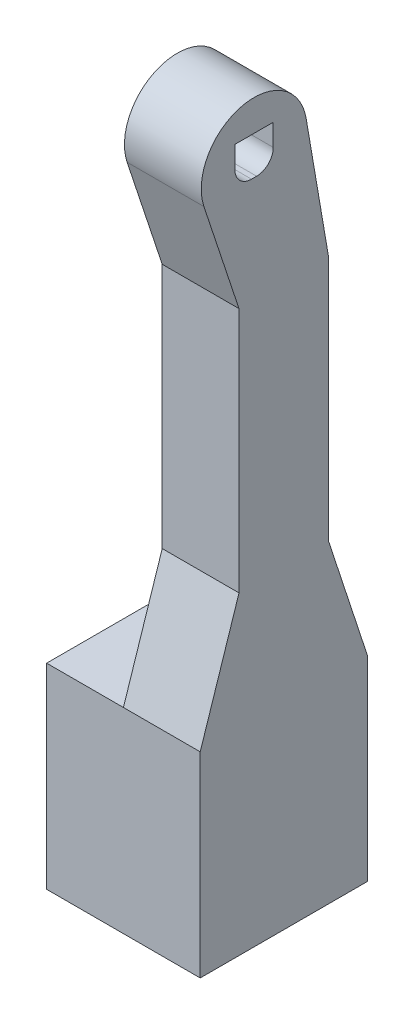
from build123d import *

# Parameters (mm, degrees)
BOSS_EXTRUDE2_DEPTH = 6
BOSS_EXTRUDE3_DEPTH = 6


with BuildPart() as part:
    # Sketch1 → Boss-Extrude2 (new body)
    with BuildSketch(Plane(origin=(0, 0, 0), x_dir=(0, 0, -1), z_dir=(1, 0, 0))):
        Polygon((-6.530112864, 15.3052734), (-6.530112864, 0), (-3, 0), (-3, 9.82), (3, 9.82), (3, 0), (6.530112864, 0), (6.530112864, 15.3052734), align=None)
    extrude(amount=-BOSS_EXTRUDE2_DEPTH)

    # Sketch1<4> → Boss-Extrude3 (add)
    with BuildSketch(Plane(origin=(0, 0, 0), x_dir=(0, 0, -1), z_dir=(1, 0, 0))):
        with BuildLine():
            Line((6.530112864, 0), (6.530112864, 15.3052734))
            Line((6.530112864, 15.3052734), (3.498344074, 24.541666174))
            Line((3.498344074, 24.541666174), (3.498344074, 43.778718631))
            Line((3.498344074, 43.778718631), (1.742466173, 54.048264378))
            ThreePointArc((1.742466173, 54.048264378), (-3.323802498, 57.355930134), (-6.240866628, 52.055131338))
            Line((-6.240866628, 52.055131338), (-3.498344074, 43.778718631))
            Line((-3.498344074, 43.778718631), (-3.498344074, 24.541666174))
            Line((-3.498344074, 24.541666174), (-6.530112864, 15.3052734))
            Line((-6.530112864, 15.3052734), (-6.530112864, 0))
            Line((-6.530112864, 0), (6.530112864, 0))
        make_face()
        with BuildLine():
            ThreePointArc((-2.524402568, 52.052914737), (-3.443641384, 52.433675922), (-3.824402568, 53.352914737))
            Line((-3.824402568, 53.352914737), (-3.824402568, 55.052914737))
            Line((-3.824402568, 55.052914737), (-0.824402568, 55.052914737))
            Line((-0.824402568, 55.052914737), (-0.824402568, 53.352914737))
            ThreePointArc((-0.824402568, 53.352914737), (-1.205163753, 52.433675922), (-2.124402568, 52.052914737))
            Line((-2.124402568, 52.052914737), (-2.524402568, 52.052914737))
        make_face(mode=Mode.SUBTRACT)
    extrude(amount=BOSS_EXTRUDE3_DEPTH)


solid = part.part
